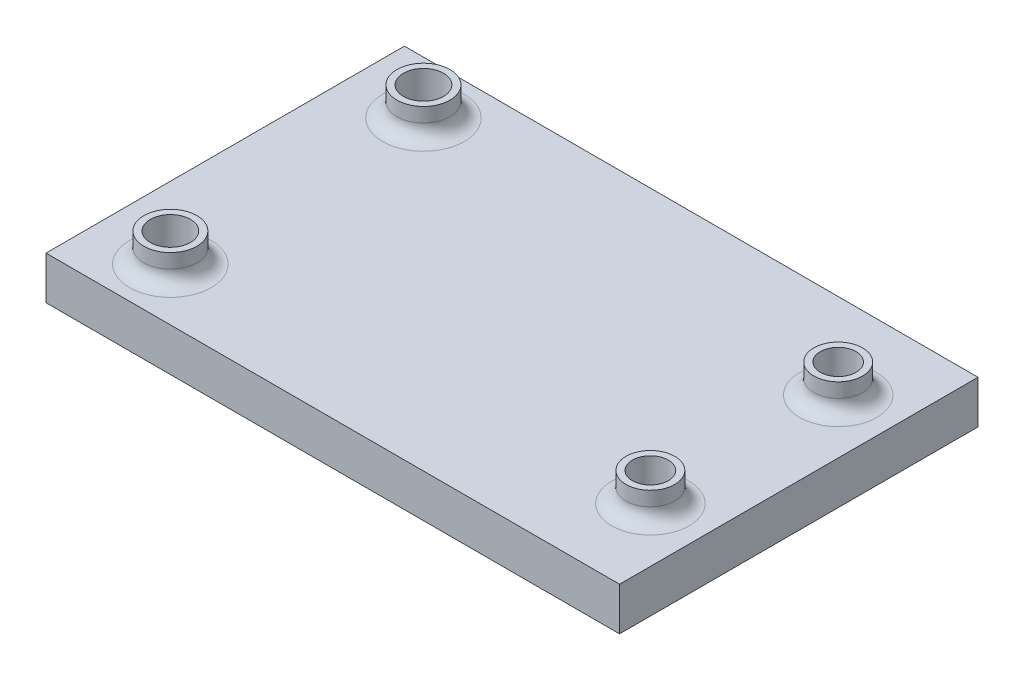
from build123d import *

# Parameters (mm, degrees)
SKETCH1_W           = 40
SKETCH1_H           = 25
SKETCH1_R           = 1.4
BOSS_EXTRUDE1_DEPTH = 3
SKETCH2_R           = 1.25
CUT_EXTRUDE1_DEPTH  = 24.774986856
SKETCH4_R           = 1.85
SKETCH4_R_2         = 1.4
SKETCH4_R_3         = 1.7
SKETCH4_R_4         = 1.25
BOSS_EXTRUDE2_DEPTH = 2
FILLET1_R           = 1
CUT_EXTRUDE2_DEPTH  = 2
CUT_EXTRUDE3_DEPTH  = 1.4


with BuildPart() as part:
    # Sketch1 → Boss-Extrude1 (new body)
    with BuildSketch(Plane(origin=(0, 0, 0), x_dir=(1, 0, 0), z_dir=(0, 1, 0))):
        Rectangle(SKETCH1_W, SKETCH1_H)
        with Locations((-15, 8.825)):
            Circle(SKETCH1_R, mode=Mode.SUBTRACT)
        with Locations((-15, -8.825)):
            Circle(SKETCH1_R, mode=Mode.SUBTRACT)
    extrude(amount=BOSS_EXTRUDE1_DEPTH)

    # Sketch2 → Cut-Extrude1 (cut, through all)
    with BuildSketch(Plane(origin=(0, 3, 0), x_dir=(1, 0, 0), z_dir=(0, 1, 0))):
        with Locations((16.2, 6.55)):
            Circle(SKETCH2_R)
        with Locations((16.2, -6.55)):
            Circle(SKETCH2_R)
    extrude(amount=-CUT_EXTRUDE1_DEPTH, mode=Mode.SUBTRACT)

    # Sketch4 → Boss-Extrude2 (add)
    # profile 1 of 4: a face of its own
    with BuildSketch(Plane(origin=(0, 3, 0), x_dir=(1, 0, 0), z_dir=(0, 1, 0))):
        with Locations((-15, 8.825)):
            Circle(SKETCH4_R)
        with Locations((-15, 8.825)):
            Circle(SKETCH4_R_2, mode=Mode.SUBTRACT)
    # profile 2 of 4: a face of its own
    with BuildSketch(Plane(origin=(0, 3, 0), x_dir=(1, 0, 0), z_dir=(0, 1, 0))):
        with Locations((16.2, 6.55)):
            Circle(SKETCH4_R_3)
        with Locations((16.2, 6.55)):
            Circle(SKETCH4_R_4, mode=Mode.SUBTRACT)
    # profile 3 of 4: a face of its own
    with BuildSketch(Plane(origin=(0, 3, 0), x_dir=(1, 0, 0), z_dir=(0, 1, 0))):
        with Locations((16.2, -6.55)):
            Circle(SKETCH4_R_3)
        with Locations((16.2, -6.55)):
            Circle(SKETCH4_R_4, mode=Mode.SUBTRACT)
    # profile 4 of 4: a face of its own
    with BuildSketch(Plane(origin=(0, 3, 0), x_dir=(1, 0, 0), z_dir=(0, 1, 0))):
        with Locations((-15, -8.825)):
            Circle(SKETCH4_R)
        with Locations((-15, -8.825)):
            Circle(SKETCH4_R_2, mode=Mode.SUBTRACT)
    extrude(amount=BOSS_EXTRUDE2_DEPTH)

    # Fillet1
    fillet1_edges = [part.edges().sort_by_distance(p)[0] for p in [
        (14.5, 3, 6.55),
        (14.5, 3, -6.55),
        (-16.85, 3, -8.825),
        (-16.85, 3, 8.825),
    ]]
    fillet(fillet1_edges, radius=FILLET1_R)

    # Sketch5 → Cut-Extrude2 (cut)
    with BuildSketch(Plane.XZ):
        Polygon((-13.470021787, 6.175), (-11.940043573, 8.825), (-13.470021787, 11.475), (-16.529978213, 11.475), (-18.059956427, 8.825), (-16.529978213, 6.175), align=None)
        Polygon((-13.470021787, -11.475), (-11.940043573, -8.825), (-13.470021787, -6.175), (-16.529978213, -6.175), (-18.059956427, -8.825), (-16.529978213, -11.475), align=None)
    extrude(amount=-CUT_EXTRUDE2_DEPTH, mode=Mode.SUBTRACT)

    # Sketch6 → Cut-Extrude3 (cut)
    with BuildSketch(Plane.XZ):
        Polygon((17.383568052, 4.5), (18.567136104, 6.55), (17.383568052, 8.6), (15.016431948, 8.6), (13.832863896, 6.55), (15.016431948, 4.5), align=None)
        Polygon((17.383568052, -8.6), (18.567136104, -6.55), (17.383568052, -4.5), (15.016431948, -4.5), (13.832863896, -6.55), (15.016431948, -8.6), align=None)
    extrude(amount=-CUT_EXTRUDE3_DEPTH, mode=Mode.SUBTRACT)


solid = part.part
